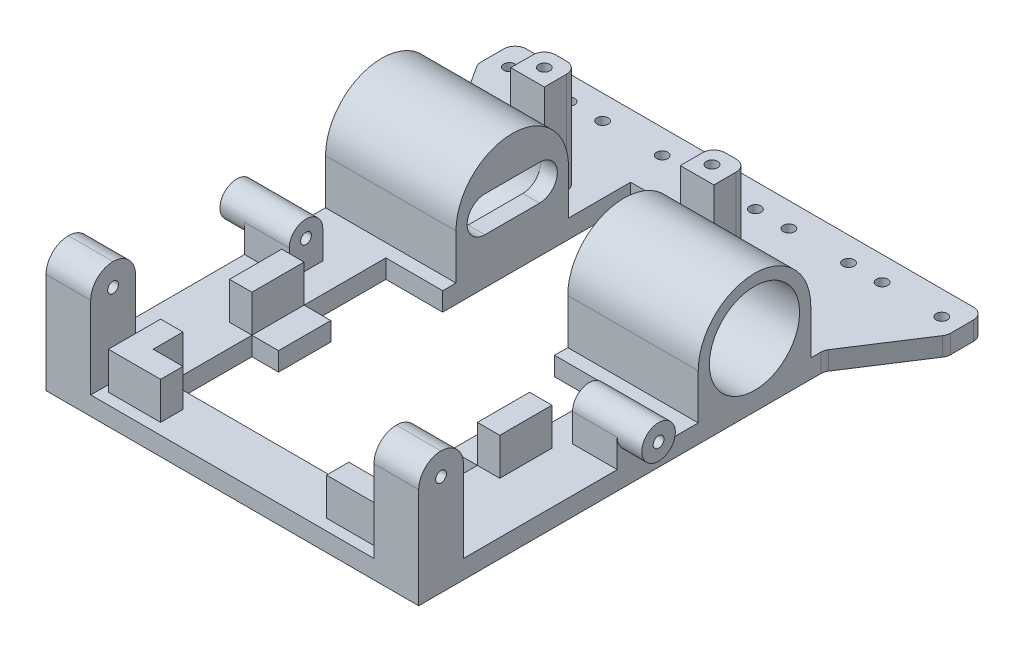
from build123d import *

# Parameters (mm, degrees)
BOSS_EXTRUDE1_DEPTH    = 5
FILLET1_R              = 3
SKETCH3_W              = 35
SKETCH3_H              = 30.2
BOSS_EXTRUDE2_DEPTH    = 27.2
CUT_EXTRUDE1_START     = -50
CUT_EXTRUDE1_DEPTH     = 35
CUT_EXTRUDE2_START     = -50
CUT_EXTRUDE2_OUTLINE_R = 12.1
CUT_EXTRUDE2_DEPTH     = 30.5
CUT_EXTRUDE3_DEPTH     = 35
SKETCH6_W              = 12
SKETCH6_H              = 9
BOSS_EXTRUDE3_DEPTH    = 17
FILLET2_R              = 4.5
SKETCH9_R              = 4.5
BOSS_EXTRUDE5_DEPTH    = 6.6
SKETCH10_R             = 1.45
CUT_EXTRUDE5_DEPTH     = 18.6
FILLET2_OF_MIRROR11_R  = 4.5
SKETCH11_W             = 12
SKETCH11_H             = 12
BOSS_EXTRUDE6_DEPTH    = 33
FILLET3_R              = 6
SKETCH12_R             = 1.45
CUT_EXTRUDE6_DEPTH     = 12
FILLET3_OF_MIRROR12_R  = 6
BOSS_EXTRUDE8_DEPTH    = 15
SKETCH16_W             = 6
SKETCH16_H             = 14
BOSS_EXTRUDE9_DEPTH    = 15
CUT_EXTRUDE7_REACH     = 123.462
SKETCH17_R             = 1.5
CUT_EXTRUDE8_DEPTH     = 122.461928192
SKETCH19_R             = 2.5
CUT_EXTRUDE9_DEPTH     = 122.461928192
SKETCH22_W             = 9
SKETCH22_H             = 9
SKETCH22_R             = 1.5
BOSS_EXTRUDE11_DEPTH   = 27.2
FILLET4_R              = 3


# Read off the part's stored shape, not the designer's step: Cut-Extrude1, Cut-Extrude2
with BuildPart() as part:
    # Sketch1 → Boss-Extrude1 (new body)
    with BuildSketch(Plane(origin=(0, 0, 0), x_dir=(1, 0, 0), z_dir=(0, 1, 0))):
        Polygon((-50, -100), (50, -100), (50, -50), (50, -35), (50, 8.781570318), (63, 28.83690568), (63, 38.83690568), (50, 38.83690568), (-50, 38.83690568), (-63, 38.83690568), (-63, 28.83690568), (-50, 8.781570318), (-50, -35), (-50, -50), align=None)
    extrude(amount=BOSS_EXTRUDE1_DEPTH)

    # Fillet1
    fillet1_edges = [part.edges().sort_by_distance(p)[0] for p in [
        (63, 2.5, -38.83690568),
        (63, 2.5, -28.83690568),
        (50, 2.5, -8.781570318),
        (-50, 2.5, -8.781570318),
        (-63, 2.5, -28.83690568),
        (-63, 2.5, -38.83690568),
    ]]
    fillet(fillet1_edges, radius=FILLET1_R)

    # Sketch3 → Boss-Extrude2 (add)
    with BuildSketch(Plane(origin=(0, 5, 0), x_dir=(1, 0, 0), z_dir=(0, 1, 0))):
        with Locations((-32.5, -9.9)):
            Rectangle(SKETCH3_W, SKETCH3_H)
    boss_extrude2 = extrude(amount=BOSS_EXTRUDE2_DEPTH)

    # Cut-Extrude1 outline → Cut-Extrude1 (cut)
    with BuildSketch(Plane.YZ.offset(CUT_EXTRUDE1_START)):
        with BuildLine():
            Line((32.2, 25), (17.1, 25))
            ThreePointArc((17.1, 25), (27.777312396, 20.577312396), (32.2, 9.9))
            Line((32.2, 9.9), (32.2, 25))
        make_face()
        with BuildLine():
            Line((32.2, -5.2), (32.2, 9.9))
            ThreePointArc((32.2, 9.9), (27.777312396, -0.777312396), (17.1, -5.2))
            Line((17.1, -5.2), (32.2, -5.2))
        make_face()
    cut_extrude1 = extrude(amount=CUT_EXTRUDE1_DEPTH, mode=Mode.SUBTRACT)

    # Cut-Extrude2 outline → Cut-Extrude2 (cut)
    with BuildSketch(Plane.YZ.offset(CUT_EXTRUDE2_START)):
        with Locations((17.1, 9.9)):
            Circle(CUT_EXTRUDE2_OUTLINE_R)
    cut_extrude2 = extrude(amount=CUT_EXTRUDE2_DEPTH, mode=Mode.SUBTRACT)

    # Sketch4<4> → Cut-Extrude3 (cut)
    with BuildSketch(Plane.ZY.offset(50)):
        with BuildLine():
            Line((2.55, 21.85), (17.25, 21.85))
            ThreePointArc((17.25, 21.85), (22, 17.1), (17.25, 12.35))
            Line((17.25, 12.35), (2.55, 12.35))
            ThreePointArc((2.55, 12.35), (-2.2, 17.1), (2.55, 21.85))
        make_face()
    cut_extrude3 = extrude(amount=-CUT_EXTRUDE3_DEPTH, mode=Mode.SUBTRACT)

    # Mirror16: Boss-Extrude2, Cut-Extrude1, Cut-Extrude2, Cut-Extrude3 across plane
    add(boss_extrude2.mirror(Plane(origin=(0, 0, 0), x_dir=(0, 0, 1), z_dir=(1, 0, 0))))
    add(cut_extrude1.mirror(Plane(origin=(0, 0, 0), x_dir=(0, 0, 1), z_dir=(1, 0, 0))), mode=Mode.SUBTRACT)
    add(cut_extrude2.mirror(Plane(origin=(0, 0, 0), x_dir=(0, 0, 1), z_dir=(1, 0, 0))), mode=Mode.SUBTRACT)
    add(cut_extrude3.mirror(Plane(origin=(0, 0, 0), x_dir=(0, 0, 1), z_dir=(1, 0, 0))), mode=Mode.SUBTRACT)

    # Sketch6 → Boss-Extrude3 (add)
    with BuildSketch(Plane(origin=(0, 0, 0), x_dir=(1, 0, 0), z_dir=(0, 1, 0))):
        with Locations((-44, -42.231514294)):
            Rectangle(SKETCH6_W, SKETCH6_H)
    boss_extrude3 = extrude(amount=BOSS_EXTRUDE3_DEPTH)

    # Fillet2
    fillet2_edges = [part.edges().sort_by_distance(p)[0] for p in [
        (-44, 17, 37.731514294),
        (-44, 17, 46.731514294),
    ]]
    fillet(fillet2_edges, radius=FILLET2_R - 0.0001)  # a hair under: the kernel refuses the full size

    # Sketch9 → Boss-Extrude5 (add)
    with BuildSketch(Plane.ZY.offset(50)):
        with Locations((42.231514294, 12.5)):
            Circle(SKETCH9_R)
    boss_extrude5 = extrude(amount=BOSS_EXTRUDE5_DEPTH)

    # Sketch10 → Cut-Extrude5 (cut)
    with BuildSketch(Plane.ZY.offset(56.6)):
        with Locations((42.231514294, 12.5)):
            Circle(SKETCH10_R)
    cut_extrude5 = extrude(amount=-CUT_EXTRUDE5_DEPTH, mode=Mode.SUBTRACT)

    # Mirror11: Boss-Extrude3, Boss-Extrude5, Cut-Extrude5 across plane
    add(boss_extrude3.mirror(Plane(origin=(0, 0, 0), x_dir=(0, 0, 1), z_dir=(1, 0, 0))))
    add(boss_extrude5.mirror(Plane(origin=(0, 0, 0), x_dir=(0, 0, 1), z_dir=(1, 0, 0))))
    add(cut_extrude5.mirror(Plane(origin=(0, 0, 0), x_dir=(0, 0, 1), z_dir=(1, 0, 0))), mode=Mode.SUBTRACT)

    # Fillet2 of Mirror11
    fillet2_of_mirror11_edges = [part.edges().sort_by_distance(p)[0] for p in [
        (44, 17, 37.731514294),
        (44, 17, 46.731514294),
    ]]
    fillet(fillet2_of_mirror11_edges, radius=FILLET2_OF_MIRROR11_R - 0.0001)  # a hair under: the kernel refuses the full size

    # Sketch11 → Boss-Extrude6 (add)
    with BuildSketch(Plane(origin=(0, 0, 0), x_dir=(1, 0, 0), z_dir=(0, 1, 0))):
        with Locations((-44, -94)):
            Rectangle(SKETCH11_W, SKETCH11_H)
    boss_extrude6 = extrude(amount=BOSS_EXTRUDE6_DEPTH)

    # Fillet3
    fillet3_edges = [part.edges().sort_by_distance(p)[0] for p in [
        (-44, 33, 88),
        (-44, 33, 100),
    ]]
    fillet(fillet3_edges, radius=FILLET3_R - 0.0001)  # a hair under: the kernel refuses the full size

    # Sketch12 → Cut-Extrude6 (cut)
    with BuildSketch(Plane.ZY.offset(50)):
        with Locations((94, 27)):
            Circle(SKETCH12_R)
    cut_extrude6 = extrude(amount=-CUT_EXTRUDE6_DEPTH, mode=Mode.SUBTRACT)

    # Mirror12: Boss-Extrude6, Cut-Extrude6 across plane
    add(boss_extrude6.mirror(Plane(origin=(0, 0, 0), x_dir=(0, 0, 1), z_dir=(1, 0, 0))))
    add(cut_extrude6.mirror(Plane(origin=(0, 0, 0), x_dir=(0, 0, 1), z_dir=(1, 0, 0))), mode=Mode.SUBTRACT)

    # Fillet3 of Mirror12
    fillet3_of_mirror12_edges = [part.edges().sort_by_distance(p)[0] for p in [
        (44, 33, 88),
        (44, 33, 100),
    ]]
    fillet(fillet3_of_mirror12_edges, radius=FILLET3_OF_MIRROR12_R - 0.0001)  # a hair under: the kernel refuses the full size

    # Sketch15 → Boss-Extrude8 (add)
    with BuildSketch(Plane(origin=(0, 0, 0), x_dir=(1, 0, 0), z_dir=(0, 1, 0))):
        Polygon((-30.25, -91), (-22.25, -91), (-22.25, -97), (-36.25, -97), (-36.25, -83), (-30.25, -83), align=None)
    boss_extrude8 = extrude(amount=BOSS_EXTRUDE8_DEPTH)

    # Mirror13: Boss-Extrude8 across plane
    add(boss_extrude8.mirror(Plane(origin=(0, 0, 0), x_dir=(0, 0, 1), z_dir=(1, 0, 0))))

    # Sketch16 → Boss-Extrude9 (add)
    with BuildSketch(Plane(origin=(0, 0, 0), x_dir=(1, 0, 0), z_dir=(0, 1, 0))):
        with Locations((-33.25, -57.5)):
            Rectangle(SKETCH16_W, SKETCH16_H)
    boss_extrude9 = extrude(amount=BOSS_EXTRUDE9_DEPTH)

    # Mirror14: Boss-Extrude9 across plane
    add(boss_extrude9.mirror(Plane(origin=(0, 0, 0), x_dir=(0, 0, 1), z_dir=(1, 0, 0))))

    # Sketch17 → Cut-Extrude7 (cut, up to next)
    with BuildSketch(Plane(origin=(0, 5, 0), x_dir=(1, 0, 0), z_dir=(0, 1, 0)), mode=Mode.PRIVATE) as cut_extrude7_sk1:
        with Locations(Location((-58, 32.33690568, 0), (0, 0, 270))):
            Circle(SKETCH17_R)
    cut_extrude7_tool1 = extrude(cut_extrude7_sk1.sketch, amount=-CUT_EXTRUDE7_REACH, mode=Mode.PRIVATE) & part.part
    # Sketch17 → Cut-Extrude7 (cut, up to next)
    with BuildSketch(Plane(origin=(0, 5, 0), x_dir=(1, 0, 0), z_dir=(0, 1, 0)), mode=Mode.PRIVATE) as cut_extrude7_sk2:
        with Locations(Location((-42, 32.33690568, 0), (0, 0, 270))):
            Circle(SKETCH17_R)
    cut_extrude7_tool2 = extrude(cut_extrude7_sk2.sketch, amount=-CUT_EXTRUDE7_REACH, mode=Mode.PRIVATE) & part.part
    # Sketch17 → Cut-Extrude7 (cut, up to next)
    with BuildSketch(Plane(origin=(0, 5, 0), x_dir=(1, 0, 0), z_dir=(0, 1, 0)), mode=Mode.PRIVATE) as cut_extrude7_sk3:
        with Locations(Location((-33, 32.33690568, 0), (0, 0, 270))):
            Circle(SKETCH17_R)
    cut_extrude7_tool3 = extrude(cut_extrude7_sk3.sketch, amount=-CUT_EXTRUDE7_REACH, mode=Mode.PRIVATE) & part.part
    # Sketch17 → Cut-Extrude7 (cut, up to next)
    with BuildSketch(Plane(origin=(0, 5, 0), x_dir=(1, 0, 0), z_dir=(0, 1, 0)), mode=Mode.PRIVATE) as cut_extrude7_sk4:
        with Locations(Location((-17, 32.33690568, 0), (0, 0, 270))):
            Circle(SKETCH17_R)
    cut_extrude7_tool4 = extrude(cut_extrude7_sk4.sketch, amount=-CUT_EXTRUDE7_REACH, mode=Mode.PRIVATE) & part.part
    # Sketch17 → Cut-Extrude7 (cut, up to next)
    with BuildSketch(Plane(origin=(0, 5, 0), x_dir=(1, 0, 0), z_dir=(0, 1, 0)), mode=Mode.PRIVATE) as cut_extrude7_sk5:
        with Locations(Location((-8, 32.33690568, 0), (0, 0, 270))):
            Circle(SKETCH17_R)
    cut_extrude7_tool5 = extrude(cut_extrude7_sk5.sketch, amount=-CUT_EXTRUDE7_REACH, mode=Mode.PRIVATE) & part.part
    # Sketch17 → Cut-Extrude7 (cut, up to next)
    with BuildSketch(Plane(origin=(0, 5, 0), x_dir=(1, 0, 0), z_dir=(0, 1, 0)), mode=Mode.PRIVATE) as cut_extrude7_sk6:
        with Locations(Location((8, 32.33690568, 0), (0, 0, 270))):
            Circle(SKETCH17_R)
    cut_extrude7_tool6 = extrude(cut_extrude7_sk6.sketch, amount=-CUT_EXTRUDE7_REACH, mode=Mode.PRIVATE) & part.part
    # Sketch17 → Cut-Extrude7 (cut, up to next)
    with BuildSketch(Plane(origin=(0, 5, 0), x_dir=(1, 0, 0), z_dir=(0, 1, 0)), mode=Mode.PRIVATE) as cut_extrude7_sk7:
        with Locations(Location((17, 32.33690568, 0), (0, 0, 270))):
            Circle(SKETCH17_R)
    cut_extrude7_tool7 = extrude(cut_extrude7_sk7.sketch, amount=-CUT_EXTRUDE7_REACH, mode=Mode.PRIVATE) & part.part
    # Sketch17 → Cut-Extrude7 (cut, up to next)
    with BuildSketch(Plane(origin=(0, 5, 0), x_dir=(1, 0, 0), z_dir=(0, 1, 0)), mode=Mode.PRIVATE) as cut_extrude7_sk8:
        with Locations(Location((33, 32.33690568, 0), (0, 0, 270))):
            Circle(SKETCH17_R)
    cut_extrude7_tool8 = extrude(cut_extrude7_sk8.sketch, amount=-CUT_EXTRUDE7_REACH, mode=Mode.PRIVATE) & part.part
    # Sketch17 → Cut-Extrude7 (cut, up to next)
    with BuildSketch(Plane(origin=(0, 5, 0), x_dir=(1, 0, 0), z_dir=(0, 1, 0)), mode=Mode.PRIVATE) as cut_extrude7_sk9:
        with Locations(Location((42, 32.33690568, 0), (0, 0, 270))):
            Circle(SKETCH17_R)
    cut_extrude7_tool9 = extrude(cut_extrude7_sk9.sketch, amount=-CUT_EXTRUDE7_REACH, mode=Mode.PRIVATE) & part.part
    # Sketch17 → Cut-Extrude7 (cut, up to next)
    with BuildSketch(Plane(origin=(0, 5, 0), x_dir=(1, 0, 0), z_dir=(0, 1, 0)), mode=Mode.PRIVATE) as cut_extrude7_sk10:
        with Locations(Location((58, 32.33690568, 0), (0, 0, 270))):
            Circle(SKETCH17_R)
    cut_extrude7_tool10 = extrude(cut_extrude7_sk10.sketch, amount=-CUT_EXTRUDE7_REACH, mode=Mode.PRIVATE) & part.part
    add(cut_extrude7_tool1.solids().sort_by_distance((-58, 5, -32.336906))[0], mode=Mode.SUBTRACT)
    add(cut_extrude7_tool2.solids().sort_by_distance((-42, 5, -32.336906))[0], mode=Mode.SUBTRACT)
    add(cut_extrude7_tool3.solids().sort_by_distance((-33, 5, -32.336906))[0], mode=Mode.SUBTRACT)
    add(cut_extrude7_tool4.solids().sort_by_distance((-17, 5, -32.336906))[0], mode=Mode.SUBTRACT)
    add(cut_extrude7_tool5.solids().sort_by_distance((-8, 5, -32.336906))[0], mode=Mode.SUBTRACT)
    add(cut_extrude7_tool6.solids().sort_by_distance((8, 5, -32.336906))[0], mode=Mode.SUBTRACT)
    add(cut_extrude7_tool7.solids().sort_by_distance((17, 5, -32.336906))[0], mode=Mode.SUBTRACT)
    add(cut_extrude7_tool8.solids().sort_by_distance((33, 5, -32.336906))[0], mode=Mode.SUBTRACT)
    add(cut_extrude7_tool9.solids().sort_by_distance((42, 5, -32.336906))[0], mode=Mode.SUBTRACT)
    add(cut_extrude7_tool10.solids().sort_by_distance((58, 5, -32.336906))[0], mode=Mode.SUBTRACT)

    # Sketch18 → Cut-Extrude8 (cut, through all)
    with BuildSketch(Plane(origin=(0, 5, 0), x_dir=(1, 0, 0), z_dir=(0, 1, 0))):
        Polygon((-15, -28.55812955), (-15, 21.858699048), (15, 21.858699048), (15, -28.55812955), (30.25, -28.55812955), (30.25, -50.5), (23.090471798, -50.5), (23.090471798, -64.5), (30.25, -64.5), (30.25, -86.538738957), (15, -86.538738957), (-15, -86.538738957), (-30.25, -86.538738957), (-30.25, -64.5), (-23.090471798, -64.5), (-23.090471798, -50.5), (-30.25, -50.5), (-30.25, -28.55812955), align=None)
    extrude(amount=-CUT_EXTRUDE8_DEPTH, mode=Mode.SUBTRACT)

    # Sketch19 → Cut-Extrude9 (cut, through all)
    with BuildSketch(Plane(origin=(0, 5, 0), x_dir=(1, 0, 0), z_dir=(0, 1, 0))):
        with Locations(Location((0, 27.733018315, 0), (0, 0, 270))):
            Circle(SKETCH19_R)
    extrude(amount=-CUT_EXTRUDE9_DEPTH, mode=Mode.SUBTRACT)

    # Sketch22 → Boss-Extrude11 (add)
    # profile 1 of 2: a face of its own
    with BuildSketch(Plane(origin=(0, 5, 0), x_dir=(1, 0, 0), z_dir=(0, 1, 0))):
        with Locations((19.5, 9.7)):
            Rectangle(SKETCH22_W, SKETCH22_H)
        with Locations(Location((19, 9.7, 0), (0, 0, 270))):
            Circle(SKETCH22_R, mode=Mode.SUBTRACT)
    # profile 2 of 2: a face of its own
    with BuildSketch(Plane(origin=(0, 5, 0), x_dir=(1, 0, 0), z_dir=(0, 1, 0))):
        with Locations((-26, 9.7)):
            Rectangle(SKETCH22_W, SKETCH22_H)
        with Locations(Location((-26, 9.7, 0), (0, 0, 270))):
            Circle(SKETCH22_R, mode=Mode.SUBTRACT)
    extrude(amount=BOSS_EXTRUDE11_DEPTH)

    # Fillet4
    fillet4_edges = [part.edges().sort_by_distance(p)[0] for p in [
        (15, 18.6, -14.2),
        (24, 18.6, -14.2),
        (-21.5, 18.6, -14.2),
        (-30.5, 18.6, -14.2),
    ]]
    fillet(fillet4_edges, radius=FILLET4_R)


solid = part.part
